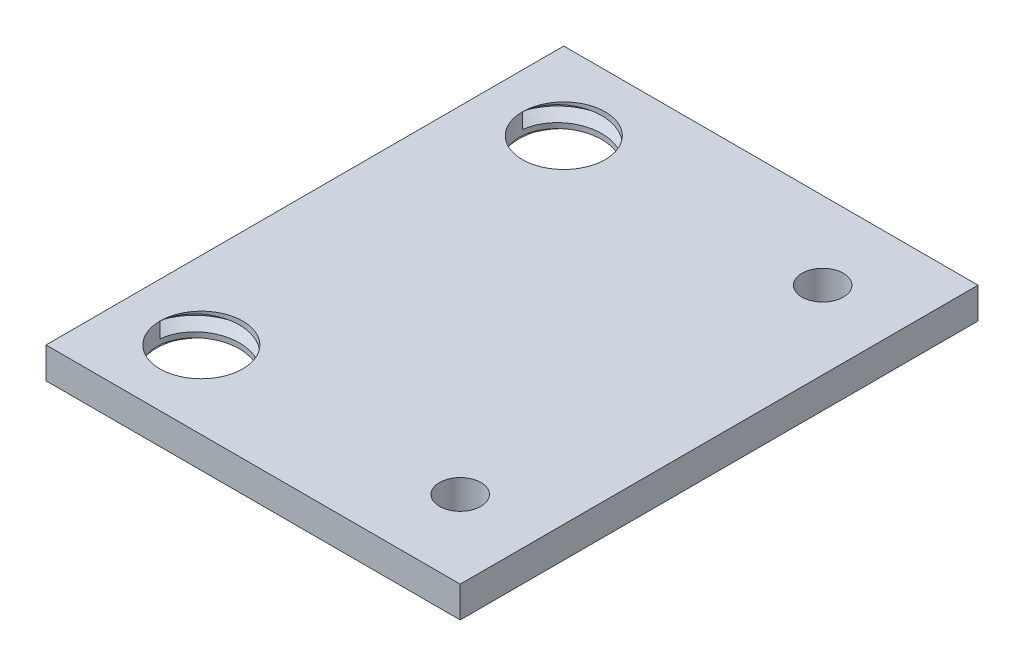
from build123d import *

# Parameters (mm, degrees)
SKETCH1_W           = 40
SKETCH1_H           = 50
SKETCH1_R           = 2
SKETCH1_R_2         = 4
BOSS_EXTRUDE1_DEPTH = 3
THREAD1_PITCH       = 2
THREAD2_PITCH       = 2


with BuildPart() as part:
    # Sketch1 → Boss-Extrude1 (new body)
    with BuildSketch(Plane(origin=(0, 0, 0), x_dir=(1, 0, 0), z_dir=(0, 1, 0))):
        with Locations((-68.096050638, -21.269649337)):
            Rectangle(SKETCH1_W, SKETCH1_H)
        with Locations(Location((-55.596050638, -3.769649337, 0), (0, 0, 270))):
            Circle(SKETCH1_R, mode=Mode.SUBTRACT)
        with Locations(Location((-55.596050638, -38.769649337, 0), (0, 0, 90))):
            Circle(SKETCH1_R, mode=Mode.SUBTRACT)
        with Locations(Location((-80.596050638, -38.769649337, 0), (0, 0, 270))):
            Circle(SKETCH1_R_2, mode=Mode.SUBTRACT)
        with Locations(Location((-80.596050638, -3.769649337, 0), (0, 0, 90))):
            Circle(SKETCH1_R_2, mode=Mode.SUBTRACT)
    extrude(amount=BOSS_EXTRUDE1_DEPTH)

    # Thread1: the profile of Thread Profile1 profile screwed along a right-hand helix of 1.5 turns, 10 arcs to a turn; built about Z, then put on its axis
    thread1_z = Axis((0, 0, 0), (0, 0, 1))
    thread1_corners = [(3.9997, 0, -0.000173205), (5.08253175, 0, 0.624999997), (5.08253175, 0, 0.874999997), (3.9997, 0, 1.5001732)]
    with BuildLine(mode=Mode.PRIVATE) as thread1_profile:
        Line(thread1_corners[0], thread1_corners[1])
        Line(thread1_corners[1], thread1_corners[2])
        Line(thread1_corners[2], thread1_corners[3])
        Line(thread1_corners[3], thread1_corners[0])
    thread1_cap = Face(thread1_profile.wire())
    thread1_turn_angles = [0, 18, 36, 54, 72, 90, 108, 126, 144, 162, 180, 198, 216, 234, 252, 270, 288, 306, 324, 342, 360]
    thread1_turn_weights = [1, 0.9510565162951535, 1, 0.9510565162951535, 1, 0.9510565162951535, 1, 0.9510565162951535, 1, 0.9510565162951535, 1, 0.9510565162951535, 1, 0.9510565162951535, 1, 0.9510565162951535, 1, 0.9510565162951535, 1, 0.9510565162951535, 1]
    thread1_turn_rails = [Edge.make_bspline([Vector(p[0], p[1], 0).rotate(thread1_z, thread1_turn_angles[k]) / thread1_turn_weights[k] + Vector(0, 0, p[2] + THREAD1_PITCH * thread1_turn_angles[k] / 360) for k in range(21)], [0, 0, 0, 1, 1, 2, 2, 3, 3, 4, 4, 5, 5, 6, 6, 7, 7, 8, 8, 9, 9, 10, 10, 10], 2, thread1_turn_weights) for p in thread1_corners]
    thread1_turn_sides = [Face.make_surface_from_curves(thread1_turn_rails[p[0]], thread1_turn_rails[p[1]]) for p in [(0, 1), (1, 2), (2, 3), (3, 0)]]
    thread1_last_angles = [360, 378, 396, 414, 432, 450, 468, 486, 504, 522, 540]
    thread1_last_weights = [1, 0.9510565162951535, 1, 0.9510565162951535, 1, 0.9510565162951535, 1, 0.9510565162951535, 1, 0.9510565162951535, 1]
    thread1_last_rails = [Edge.make_bspline([Vector(p[0], p[1], 0).rotate(thread1_z, thread1_last_angles[k]) / thread1_last_weights[k] + Vector(0, 0, p[2] + THREAD1_PITCH * thread1_last_angles[k] / 360) for k in range(11)], [0, 0, 0, 1, 1, 2, 2, 3, 3, 4, 4, 5, 5, 5], 2, thread1_last_weights) for p in thread1_corners]
    thread1_last_sides = [Face.make_surface_from_curves(thread1_last_rails[p[0]], thread1_last_rails[p[1]]) for p in [(0, 1), (1, 2), (2, 3), (3, 0)]]
    thread1 = Plane(origin=(-80.596050638, 3, 3.769649337), x_dir=(-1, 0, 0), z_dir=(0, -1, 0)) * Solid(Shell([*thread1_turn_sides, *thread1_last_sides, thread1_cap, thread1_cap.rotate(thread1_z, 540).moved(Location((0, 0, THREAD1_PITCH * 540 / 360)))]))
    add(thread1, mode=Mode.SUBTRACT)

    # Thread2: the profile of Thread Profile2 profile screwed along a right-hand helix of 1.5 turns, 10 arcs to a turn; built about Z, then put on its axis
    thread2_z = Axis((0, 0, 0), (0, 0, 1))
    thread2_corners = [(3.9997, 0, -0.000173205), (5.08253175, 0, 0.624999997), (5.08253175, 0, 0.874999997), (3.9997, 0, 1.5001732)]
    with BuildLine(mode=Mode.PRIVATE) as thread2_profile:
        Line(thread2_corners[0], thread2_corners[1])
        Line(thread2_corners[1], thread2_corners[2])
        Line(thread2_corners[2], thread2_corners[3])
        Line(thread2_corners[3], thread2_corners[0])
    thread2_cap = Face(thread2_profile.wire())
    thread2_turn_angles = [0, 18, 36, 54, 72, 90, 108, 126, 144, 162, 180, 198, 216, 234, 252, 270, 288, 306, 324, 342, 360]
    thread2_turn_weights = [1, 0.9510565162951535, 1, 0.9510565162951535, 1, 0.9510565162951535, 1, 0.9510565162951535, 1, 0.9510565162951535, 1, 0.9510565162951535, 1, 0.9510565162951535, 1, 0.9510565162951535, 1, 0.9510565162951535, 1, 0.9510565162951535, 1]
    thread2_turn_rails = [Edge.make_bspline([Vector(p[0], p[1], 0).rotate(thread2_z, thread2_turn_angles[k]) / thread2_turn_weights[k] + Vector(0, 0, p[2] + THREAD2_PITCH * thread2_turn_angles[k] / 360) for k in range(21)], [0, 0, 0, 1, 1, 2, 2, 3, 3, 4, 4, 5, 5, 6, 6, 7, 7, 8, 8, 9, 9, 10, 10, 10], 2, thread2_turn_weights) for p in thread2_corners]
    thread2_turn_sides = [Face.make_surface_from_curves(thread2_turn_rails[p[0]], thread2_turn_rails[p[1]]) for p in [(0, 1), (1, 2), (2, 3), (3, 0)]]
    thread2_last_angles = [360, 378, 396, 414, 432, 450, 468, 486, 504, 522, 540]
    thread2_last_weights = [1, 0.9510565162951535, 1, 0.9510565162951535, 1, 0.9510565162951535, 1, 0.9510565162951535, 1, 0.9510565162951535, 1]
    thread2_last_rails = [Edge.make_bspline([Vector(p[0], p[1], 0).rotate(thread2_z, thread2_last_angles[k]) / thread2_last_weights[k] + Vector(0, 0, p[2] + THREAD2_PITCH * thread2_last_angles[k] / 360) for k in range(11)], [0, 0, 0, 1, 1, 2, 2, 3, 3, 4, 4, 5, 5, 5], 2, thread2_last_weights) for p in thread2_corners]
    thread2_last_sides = [Face.make_surface_from_curves(thread2_last_rails[p[0]], thread2_last_rails[p[1]]) for p in [(0, 1), (1, 2), (2, 3), (3, 0)]]
    thread2 = Plane(origin=(-80.596050638, 3, 38.769649337), x_dir=(-1, 0, 0), z_dir=(0, -1, 0)) * Solid(Shell([*thread2_turn_sides, *thread2_last_sides, thread2_cap, thread2_cap.rotate(thread2_z, 540).moved(Location((0, 0, THREAD2_PITCH * 540 / 360)))]))
    add(thread2, mode=Mode.SUBTRACT)


solid = part.part
